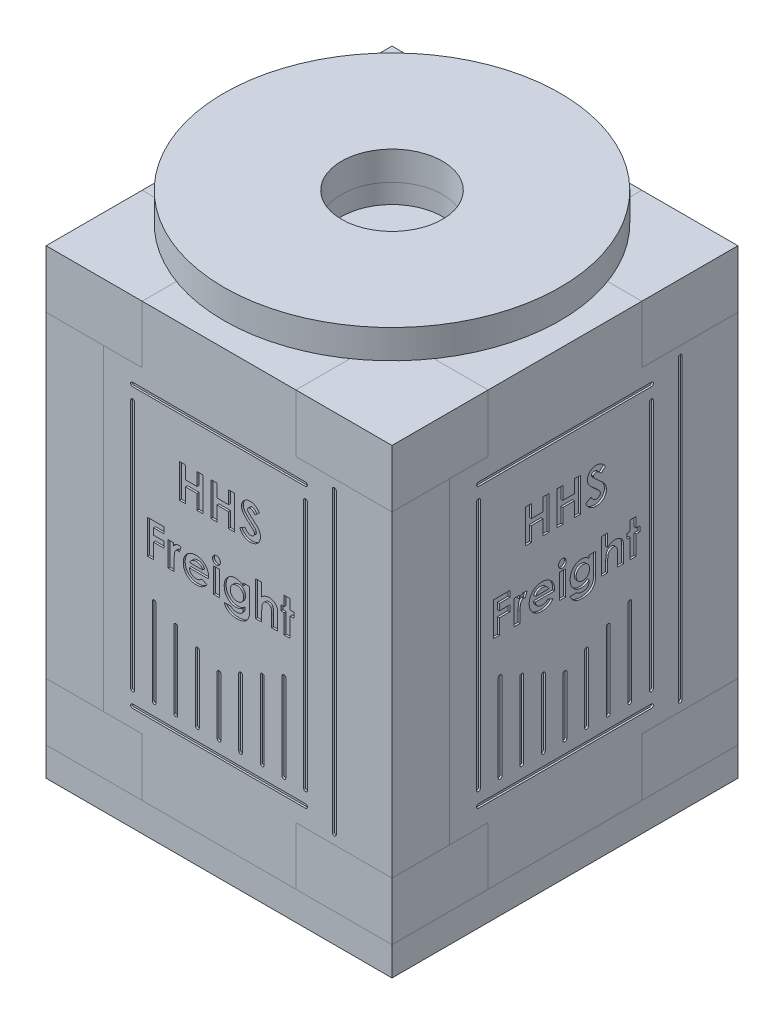
from build123d import *

# Parameters (mm, degrees)
BOSS_EXTRUDE1_DEPTH = 6
BOSS_EXTRUDE2_START = 6
SKETCH1_3_R         = 16
SKETCH1_3_R_2       = 5.25
BOSS_EXTRUDE2_DEPTH = 2
BOSS_EXTRUDE3_DEPTH = 6
SKETCH4_W           = 0.628205128
SKETCH4_H           = 2.557692308
CUT_EXTRUDE1_DEPTH  = 0.2
CIRPATTERN1_COUNT   = 4
BOSS_EXTRUDE4_START = -39
BOSS_EXTRUDE4_DEPTH = 6
SKETCH3_W           = 36
SKETCH3_H           = 36
SKETCH3_R           = 17
BOSS_EXTRUDE5_DEPTH = 3
SKETCH5_R           = 25.455844123
SKETCH5_R_2         = 10
CUT_EXTRUDE2_DEPTH  = 57.107040621
SKETCH6_R           = 17.5
SKETCH6_R_2         = 5.25
BOSS_EXTRUDE6_DEPTH = 3


with BuildPart() as part:
    # Sketch1 → Boss-Extrude1 (new body)
    with BuildSketch(Plane(origin=(0, 0, 0), x_dir=(1, 0, 0), z_dir=(0, 1, 0))):
        Polygon((18, 8), (18, 18), (8, 18), (8, 12), (-8, 12), (-8, 18), (-18, 18), (-18, 8), (-12, 8), (-12, -8), (-18, -8), (-18, -18), (-8, -18), (-8, -12), (8, -12), (8, -18), (18, -18), (18, -8), (12, -8), (12, 8), align=None)
    extrude(amount=BOSS_EXTRUDE1_DEPTH)


with BuildPart() as body_2:
    # Sketch1<3> → Boss-Extrude2 (new body)
    with BuildSketch(Plane(origin=(0, 0, 0), x_dir=(1, 0, 0), z_dir=(0, 1, 0)).offset(BOSS_EXTRUDE2_START)):
        Circle(SKETCH1_3_R)
        Circle(SKETCH1_3_R_2, mode=Mode.SUBTRACT)
    extrude(amount=BOSS_EXTRUDE2_DEPTH)

    # Sketch5 → Cut-Extrude2 (cut, through all)
    with BuildSketch(Plane(origin=(0, 8, 0), x_dir=(1, 0, 0), z_dir=(0, 1, 0))):
        Circle(SKETCH5_R)
        Circle(SKETCH5_R_2, mode=Mode.SUBTRACT)
    extrude(amount=-CUT_EXTRUDE2_DEPTH, mode=Mode.SUBTRACT)


with BuildPart() as body_3:
    # Sketch2 → Boss-Extrude3 (new body)
    with BuildSketch(Plane.XY.offset(12)):
        Polygon((-8, 6), (-8, 0), (-12, 0), (-12, -33), (-8, -33), (-8, -39), (8, -39), (8, -33), (18, -33), (18, 0), (8, 0), (8, 6), align=None)
    extrude(amount=BOSS_EXTRUDE3_DEPTH)

    # Sketch4 → Cut-Extrude1 (cut)
    # profile 1 of 23: a face of its own
    with BuildSketch(Plane.XY.offset(18)):
        with BuildLine():
            Line((12.2, -1), (12.2, -32))
            ThreePointArc((12.2, -32), (12, -32.2), (11.8, -32))
            Line((11.8, -32), (11.8, -1))
            ThreePointArc((11.8, -1), (12, -0.8), (12.2, -1))
        make_face()
    # profile 2 of 23: a face of its own
    with BuildSketch(Plane.XY.offset(18)):
        with BuildLine():
            Line((-9, -1.8), (9, -1.8))
            ThreePointArc((9, -1.8), (9.2, -2), (9, -2.2))
            Line((9, -2.2), (-9, -2.2))
            ThreePointArc((-9, -2.2), (-9.2, -2), (-9, -1.8))
        make_face()
    # profile 3 of 23: a face of its own
    with BuildSketch(Plane.XY.offset(18)):
        with BuildLine():
            Line((-8.8, -3.5), (-8.8, -29.5))
            ThreePointArc((-8.8, -29.5), (-9, -29.7), (-9.2, -29.5))
            Line((-9.2, -29.5), (-9.2, -3.5))
            ThreePointArc((-9.2, -3.5), (-9, -3.3), (-8.8, -3.5))
        make_face()
    # profile 4 of 23: a face of its own
    with BuildSketch(Plane.XY.offset(18)):
        with BuildLine():
            Line((9.2, -3.5), (9.2, -29.5))
            ThreePointArc((9.2, -29.5), (9, -29.7), (8.8, -29.5))
            Line((8.8, -29.5), (8.8, -3.5))
            ThreePointArc((8.8, -3.5), (9, -3.3), (9.2, -3.5))
        make_face()
    # profile 5 of 23: a face of its own
    with BuildSketch(Plane.XY.offset(18)):
        with BuildLine():
            Line((-9, -30.8), (9, -30.8))
            ThreePointArc((9, -30.8), (9.2, -31), (9, -31.2))
            Line((9, -31.2), (-9, -31.2))
            ThreePointArc((-9, -31.2), (-9.2, -31), (-9, -30.8))
        make_face()
    # profile 6 of 23: a face of its own
    with BuildSketch(Plane.XY.offset(18)):
        with BuildLine():
            Line((-4.3, -21.5), (-4.3, -29.5))
            ThreePointArc((-4.3, -29.5), (-4.5, -29.7), (-4.7, -29.5))
            Line((-4.7, -29.5), (-4.7, -21.5))
            ThreePointArc((-4.7, -21.5), (-4.5, -21.3), (-4.3, -21.5))
        make_face()
    # profile 7 of 23: a face of its own
    with BuildSketch(Plane.XY.offset(18)):
        with BuildLine():
            Line((0.2, -23.5), (0.2, -29.5))
            ThreePointArc((0.2, -29.5), (0, -29.7), (-0.2, -29.5))
            Line((-0.2, -29.5), (-0.2, -23.5))
            ThreePointArc((-0.2, -23.5), (0, -23.3), (0.2, -23.5))
        make_face()
    # profile 8 of 23: a face of its own
    with BuildSketch(Plane.XY.offset(18)):
        with BuildLine():
            Line((4.7, -21.5), (4.7, -29.5))
            ThreePointArc((4.7, -29.5), (4.5, -29.7), (4.3, -29.5))
            Line((4.3, -29.5), (4.3, -21.5))
            ThreePointArc((4.3, -21.5), (4.5, -21.3), (4.7, -21.5))
        make_face()
    # profile 9 of 23: a face of its own
    with BuildSketch(Plane.XY.offset(18)):
        with BuildLine():
            Line((-6.95, -29.5), (-6.95, -20.5))
            ThreePointArc((-6.95, -20.5), (-6.75, -20.3), (-6.55, -20.5))
            Line((-6.55, -20.5), (-6.55, -29.5))
            ThreePointArc((-6.55, -29.5), (-6.75, -29.7), (-6.95, -29.5))
        make_face()
    # profile 10 of 23: a face of its own
    with BuildSketch(Plane.XY.offset(18)):
        with BuildLine():
            Line((-2.45, -29.5), (-2.45, -22.5))
            ThreePointArc((-2.45, -22.5), (-2.25, -22.3), (-2.05, -22.5))
            Line((-2.05, -22.5), (-2.05, -29.5))
            ThreePointArc((-2.05, -29.5), (-2.25, -29.7), (-2.45, -29.5))
        make_face()
    # profile 11 of 23: a face of its own
    with BuildSketch(Plane.XY.offset(18)):
        with BuildLine():
            Line((2.05, -29.5), (2.05, -22.5))
            ThreePointArc((2.05, -22.5), (2.25, -22.3), (2.45, -22.5))
            Line((2.45, -22.5), (2.45, -29.5))
            ThreePointArc((2.45, -29.5), (2.25, -29.7), (2.05, -29.5))
        make_face()
    # profile 12 of 23: a face of its own
    with BuildSketch(Plane.XY.offset(18)):
        with BuildLine():
            Line((6.55, -29.5), (6.55, -20.5))
            ThreePointArc((6.55, -20.5), (6.75, -20.3), (6.95, -20.5))
            Line((6.95, -20.5), (6.95, -29.5))
            ThreePointArc((6.95, -29.5), (6.75, -29.7), (6.55, -29.5))
        make_face()
    # profile 13 of 23: a face of its own
    with BuildSketch(Plane.XY.offset(18)):
        Polygon((-4.128205128, -6.5), (-3.5, -6.5), (-3.5, -7.846153846), (-2.288461538, -7.846153846), (-2.288461538, -6.5), (-1.66025641, -6.5), (-1.66025641, -10), (-2.288461538, -10), (-2.288461538, -8.474358974), (-3.5, -8.474358974), (-3.5, -10), (-4.128205128, -10), align=None)
    # profile 14 of 23: a face of its own
    with BuildSketch(Plane.XY.offset(18)):
        Polygon((-0.852564103, -6.5), (-0.224358974, -6.5), (-0.224358974, -7.846153846), (0.987179487, -7.846153846), (0.987179487, -6.5), (1.615384615, -6.5), (1.615384615, -10), (0.987179487, -10), (0.987179487, -8.474358974), (-0.224358974, -8.474358974), (-0.224358974, -10), (-0.852564103, -10), align=None)
    # profile 15 of 23: a face of its own
    with BuildSketch(Plane.XY.offset(18)):
        with BuildLine():
            Line((4.217948718, -6.967648237), (3.748197115, -7.397435897))
            add(Edge.make_bspline(
                [(3.748197115, -7.397435897), (3.710604112, -7.342284932), (3.651542255, -7.266135742), (3.564477212, -7.179353173), (3.501863654, -7.128057989), (3.438377685, -7.088147573), (3.354583209, -7.050940217), (3.288282332, -7.038318777), (3.244791667, -7.038461538)],
                knots=[0, 0, 0, 0, 0.31182434, 0.448432767, 0.573381197, 0.689077147, 0.797572901, 1, 1, 1, 1], degree=3))
            add(Edge.make_bspline(
                [(3.244791667, -7.038461538), (3.206557712, -7.038399993), (3.149571765, -7.045224753), (3.082751576, -7.077110914), (3.040224997, -7.10737123), (3.006585134, -7.143857678), (2.971209697, -7.19395035), (2.961872016, -7.238927969), (2.961538462, -7.267728365)],
                knots=[0, 0, 0, 0, 0.285992887, 0.416634394, 0.547379946, 0.671582838, 0.784400739, 1, 1, 1, 1], degree=3))
            add(Edge.make_bspline(
                [(2.961538462, -7.267728365), (2.961107528, -7.297110404), (2.972276565, -7.357062053), (3.001454887, -7.410477964), (3.019731571, -7.435296474)],
                knots=[0, 0, 0, 0, 0.487115475, 1, 1, 1, 1], degree=3))
            add(Edge.make_bspline(
                [(3.019731571, -7.435296474), (3.037639838, -7.4592137), (3.072502271, -7.496699757), (3.126027145, -7.551264825), (3.181107837, -7.603455423), (3.244687616, -7.664263302), (3.350735792, -7.759198249), (3.435025348, -7.834526673), (3.495092147, -7.88681891)],
                knots=[0, 0, 0, 0, 0.136349281, 0.233805212, 0.349411224, 0.48317915, 0.635966856, 1, 1, 1, 1], degree=3))
            add(Edge.make_bspline(
                [(3.495092147, -7.88681891), (3.550817819, -7.935344696), (3.63071994, -8.00351582), (3.729772015, -8.09103644), (3.791023351, -8.144971888), (3.842723305, -8.191668852), (3.893577336, -8.239212829), (3.926991558, -8.271250658), (3.945913462, -8.290665064)],
                knots=[0, 0, 0, 0, 0.366184141, 0.520457298, 0.655012135, 0.770624226, 0.865677185, 1, 1, 1, 1], degree=3))
            add(Edge.make_bspline(
                [(3.945913462, -8.290665064), (4.006241792, -8.353963636), (4.088556133, -8.449774248), (4.176935089, -8.585267984), (4.226113179, -8.681960916), (4.263196454, -8.77952575), (4.298678861, -8.915500056), (4.30776444, -9.02179742), (4.307692308, -9.093449519)],
                knots=[0, 0, 0, 0, 0.289954183, 0.417138648, 0.535255184, 0.648751095, 0.762405462, 1, 1, 1, 1], degree=3))
            add(Edge.make_bspline(
                [(4.307692308, -9.093449519), (4.308820374, -9.16287785), (4.298614436, -9.265107687), (4.269277064, -9.396773252), (4.236127629, -9.488488932), (4.195659109, -9.576291703), (4.144943936, -9.6588161), (4.085381323, -9.736896695), (4.017114647, -9.80913792), (3.941603277, -9.87469164), (3.860610211, -9.933049761), (3.773343501, -9.981229434), (3.68054822, -10.020910986), (3.582276138, -10.051439785), (3.441347956, -10.082302663), (3.331280311, -10.089881551), (3.256710737, -10.08974359)],
                knots=[0, 0, 0, 0, 0.127926544, 0.18904691, 0.248543693, 0.307607127, 0.36724766, 0.426963056, 0.488617128, 0.550391855, 0.611330734, 0.672556085, 0.734024191, 0.797340621, 0.862249627, 1, 1, 1, 1], degree=3))
            add(Edge.make_bspline(
                [(3.256710737, -10.08974359), (3.197436711, -10.089698506), (3.109666377, -10.084513817), (2.995733877, -10.065700012), (2.914458564, -10.04585589), (2.835916554, -10.020681236), (2.760105014, -9.989938897), (2.687547198, -9.953144246), (2.617694112, -9.911056073), (2.550885372, -9.862186008), (2.486276011, -9.807533407), (2.424508565, -9.746257379), (2.365283335, -9.678503891), (2.308991261, -9.604076966), (2.233715718, -9.495014576), (2.1853492, -9.405752047), (2.153846154, -9.344451122)],
                knots=[0, 0, 0, 0, 0.125868382, 0.18624025, 0.244976651, 0.303357688, 0.361230317, 0.418489049, 0.475936712, 0.534203744, 0.594059429, 0.655468694, 0.718771685, 0.784974607, 0.853522316, 1, 1, 1, 1], degree=3))
            Line((2.153846154, -9.344451122), (2.706330128, -9.012820513))
            add(Edge.make_bspline(
                [(2.706330128, -9.012820513), (2.743958455, -9.081547014), (2.805143824, -9.176722541), (2.900012015, -9.285787913), (2.971068684, -9.34952835), (3.04447885, -9.399514574), (3.144851568, -9.447017414), (3.226154376, -9.461649204), (3.279847756, -9.461538462)],
                knots=[0, 0, 0, 0, 0.307611547, 0.442138888, 0.566229194, 0.681222208, 0.789558005, 1, 1, 1, 1], degree=3))
            add(Edge.make_bspline(
                [(3.279847756, -9.461538462), (3.332637961, -9.461938616), (3.410408062, -9.449952168), (3.504523769, -9.407523755), (3.56432708, -9.36334599), (3.614865787, -9.312288334), (3.664412976, -9.237527546), (3.68023602, -9.172635217), (3.679487179, -9.129907853)],
                knots=[0, 0, 0, 0, 0.275473311, 0.404345843, 0.535429711, 0.661427401, 0.77786684, 1, 1, 1, 1], degree=3))
            add(Edge.make_bspline(
                [(3.679487179, -9.129907853), (3.679393335, -9.089228663), (3.667128045, -9.027295825), (3.631746581, -8.94875075), (3.599907735, -8.899292826), (3.567445124, -8.857885611), (3.536413837, -8.822007652), (3.498622433, -8.782369038), (3.454171056, -8.738919199), (3.403643974, -8.691278), (3.324378938, -8.61872962), (3.260240976, -8.563987211), (3.215344551, -8.526241987)],
                knots=[0, 0, 0, 0, 0.155090822, 0.238351561, 0.32840414, 0.37938386, 0.439617644, 0.509831416, 0.588874645, 0.677436354, 0.77554672, 1, 1, 1, 1], degree=3))
            add(Edge.make_bspline(
                [(3.215344551, -8.526241987), (3.129530539, -8.454270328), (3.00745093, -8.348833194), (2.855593469, -8.209490312), (2.759604265, -8.115389489), (2.675289789, -8.02877406), (2.603211654, -7.948949049), (2.544170578, -7.875296497), (2.482021676, -7.788060941), (2.423089239, -7.681753262), (2.355878072, -7.514632271), (2.332414707, -7.383916332), (2.333333333, -7.297876603)],
                knots=[0, 0, 0, 0, 0.215201009, 0.309902452, 0.395959096, 0.473447494, 0.542140328, 0.602523333, 0.654726333, 0.747804055, 0.835278417, 1, 1, 1, 1], degree=3))
            add(Edge.make_bspline(
                [(2.333333333, -7.297876603), (2.332987333, -7.238812595), (2.341828098, -7.151242057), (2.368898713, -7.038319492), (2.397820656, -6.957913545), (2.435414959, -6.880959983), (2.481057226, -6.807081141), (2.535472114, -6.736957251), (2.59679298, -6.670634675), (2.664353149, -6.610023554), (2.73654973, -6.556527576), (2.812974041, -6.511346225), (2.893159017, -6.473857126), (2.977599722, -6.445190938), (3.096725832, -6.417559898), (3.189394759, -6.410644182), (3.251802885, -6.41025641)],
                knots=[0, 0, 0, 0, 0.12445736, 0.184840915, 0.244566821, 0.304319173, 0.365199786, 0.427420983, 0.491261689, 0.555499002, 0.618604518, 0.680494764, 0.742473305, 0.804990665, 0.868251971, 1, 1, 1, 1], degree=3))
            add(Edge.make_bspline(
                [(3.251802885, -6.41025641), (3.333981971, -6.41029759), (3.457221458, -6.425723612), (3.615290545, -6.475277854), (3.710892278, -6.519802893), (3.786960209, -6.562999189), (3.845259407, -6.602759362), (3.904581302, -6.648309948), (3.965407638, -6.69978876), (4.02659459, -6.758177595), (4.113521937, -6.845819545), (4.176516872, -6.917254334), (4.217948718, -6.967648237)],
                knots=[0, 0, 0, 0, 0.212976528, 0.319776676, 0.428556273, 0.485856803, 0.546558687, 0.611431498, 0.67982091, 0.753158505, 0.830752869, 1, 1, 1, 1], degree=3))
        make_face()
    # profile 16 of 23: a face of its own
    with BuildSketch(Plane.XY.offset(18)):
        Polygon((-7.448717949, -13.198717949), (-5.743589744, -13.198717949), (-5.743589744, -13.826923077), (-6.820512821, -13.826923077), (-6.820512821, -14.5), (-5.743589744, -14.5), (-5.743589744, -15.128205128), (-6.820512821, -15.128205128), (-6.820512821, -16.698717949), (-7.448717949, -16.698717949), align=None)
    # profile 17 of 23: a face of its own
    with BuildSketch(Plane.XY.offset(18)):
        with BuildLine():
            Line((-5.294871795, -14.141025641), (-4.756410256, -14.141025641))
            Line((-4.756410256, -14.141025641), (-4.756410256, -14.455829327))
            add(Edge.make_bspline(
                [(-4.756410256, -14.455829327), (-4.728007426, -14.400717622), (-4.679588115, -14.32212726), (-4.593859931, -14.237966489), (-4.525168988, -14.18642052), (-4.450354488, -14.146319448), (-4.344761972, -14.107749004), (-4.260802231, -14.095522201), (-4.204627404, -14.096153846)],
                knots=[0, 0, 0, 0, 0.268422379, 0.39320538, 0.516430377, 0.637792883, 0.758061252, 1, 1, 1, 1], degree=3))
            add(Edge.make_bspline(
                [(-4.204627404, -14.096153846), (-4.162738896, -14.097104936), (-4.073880523, -14.106653394), (-3.991054995, -14.14030149), (-3.948717949, -14.159254808)],
                knots=[0, 0, 0, 0, 0.474167851, 1, 1, 1, 1], degree=3))
            Line((-3.948717949, -14.159254808), (-4.143629808, -14.69140625))
            add(Edge.make_bspline(
                [(-4.143629808, -14.69140625), (-4.176309315, -14.675730075), (-4.233977006, -14.647551358), (-4.297065933, -14.634935535), (-4.324519231, -14.634615385)],
                knots=[0, 0, 0, 0, 0.570645018, 1, 1, 1, 1], degree=3))
            add(Edge.make_bspline(
                [(-4.324519231, -14.634615385), (-4.34796641, -14.634646625), (-4.383890567, -14.639831562), (-4.427496822, -14.660151418), (-4.459772128, -14.679565584), (-4.489058288, -14.706590665), (-4.518325558, -14.73786744), (-4.544117661, -14.776485806), (-4.571335741, -14.819469165), (-4.594510949, -14.872081037), (-4.614383132, -14.934888679), (-4.632088651, -15.008618937), (-4.644275763, -15.09366318), (-4.656039678, -15.189198775), (-4.665931092, -15.338620615), (-4.669322813, -15.456270451), (-4.668770032, -15.538361378)],
                knots=[0, 0, 0, 0, 0.066912404, 0.101140702, 0.136380892, 0.173597996, 0.214075626, 0.25797978, 0.305417223, 0.358684712, 0.420923911, 0.492691001, 0.574130849, 0.665182153, 0.766512664, 1, 1, 1, 1], degree=3))
            Line((-4.668770032, -15.538361378), (-4.666666667, -15.663161058))
            Line((-4.666666667, -15.663161058), (-4.666666667, -16.698717949))
            Line((-4.666666667, -16.698717949), (-5.294871795, -16.698717949))
            Line((-5.294871795, -16.698717949), (-5.294871795, -14.141025641))
        make_face()
    # profile 18 of 23: a face of its own
    with BuildSketch(Plane.XY.offset(18)):
        with BuildLine():
            Line((-1.079026442, -15.576923077), (-3.096153846, -15.576923077))
            add(Edge.make_bspline(
                [(-3.096153846, -15.576923077), (-3.088732092, -15.623038637), (-3.074437274, -15.69088242), (-3.044002653, -15.776367046), (-3.01717409, -15.835645214), (-2.986338201, -15.891464967), (-2.950375276, -15.943566219), (-2.909736355, -15.991902492), (-2.864657764, -16.036263861), (-2.815890521, -16.076012517), (-2.763671207, -16.110835168), (-2.707945983, -16.139386454), (-2.649353449, -16.163456629), (-2.587456841, -16.182505837), (-2.498740375, -16.200443117), (-2.429752461, -16.20475455), (-2.383112981, -16.205128205)],
                knots=[0, 0, 0, 0, 0.134030228, 0.198035326, 0.259812977, 0.320405484, 0.380626346, 0.441025884, 0.501201994, 0.561690671, 0.621161275, 0.68080151, 0.740902961, 0.802582416, 0.8661864, 1, 1, 1, 1], degree=3))
            add(Edge.make_bspline(
                [(-2.383112981, -16.205128205), (-2.326368973, -16.205444937), (-2.242483297, -16.196728186), (-2.134161169, -16.169505298), (-2.057289469, -16.139720321), (-1.983044395, -16.10256309), (-1.88744375, -16.039957405), (-1.822564661, -15.982045084), (-1.782251603, -15.939403045)],
                knots=[0, 0, 0, 0, 0.251339752, 0.372248681, 0.49428064, 0.616180496, 0.73979102, 1, 1, 1, 1], degree=3))
            Line((-1.782251603, -15.939403045), (-1.256410256, -16.189703526))
            add(Edge.make_bspline(
                [(-1.256410256, -16.189703526), (-1.288487437, -16.235535462), (-1.339927003, -16.301156658), (-1.415220295, -16.381218005), (-1.473466214, -16.43608588), (-1.53417863, -16.48612206), (-1.597165993, -16.531951719), (-1.663354787, -16.572340273), (-1.731420011, -16.609242815), (-1.802769119, -16.640879061), (-1.877204548, -16.667857646), (-1.954411036, -16.692244902), (-2.035363595, -16.710830982), (-2.119387862, -16.725526614), (-2.237801841, -16.739770137), (-2.328581266, -16.743578606), (-2.390124199, -16.743589744)],
                knots=[0, 0, 0, 0, 0.127328193, 0.189420031, 0.250008012, 0.309331145, 0.368386561, 0.427141744, 0.485687056, 0.544504814, 0.604586283, 0.665831547, 0.728668574, 0.793471982, 0.85991395, 1, 1, 1, 1], degree=3))
            add(Edge.make_bspline(
                [(-2.390124199, -16.743589744), (-2.484423986, -16.743719017), (-2.623719859, -16.733619859), (-2.801901969, -16.693176489), (-2.926452073, -16.652957491), (-3.043894652, -16.599795402), (-3.154285122, -16.534788561), (-3.258727131, -16.459167386), (-3.354029295, -16.371349069), (-3.440852117, -16.275763796), (-3.51711287, -16.173111781), (-3.580923198, -16.064110267), (-3.633338747, -15.949480165), (-3.674028317, -15.828929971), (-3.713985913, -15.657682722), (-3.724573496, -15.52403755), (-3.724358974, -15.433894231)],
                knots=[0, 0, 0, 0, 0.135079333, 0.198875647, 0.261192366, 0.322136005, 0.383017164, 0.444315175, 0.506362776, 0.568185367, 0.628944138, 0.689078851, 0.748665675, 0.809078028, 0.870917817, 1, 1, 1, 1], degree=3))
            add(Edge.make_bspline(
                [(-3.724358974, -15.433894231), (-3.724439875, -15.341447109), (-3.714258652, -15.204734742), (-3.673949141, -15.029555365), (-3.633137955, -14.906310515), (-3.581518013, -14.78871479), (-3.516895569, -14.677799445), (-3.440889972, -14.573177718), (-3.354379916, -14.475339091), (-3.258674014, -14.387029386), (-3.156977545, -14.308326507), (-3.048147656, -14.242750683), (-2.933415705, -14.189748334), (-2.81351415, -14.146749682), (-2.642281994, -14.107681495), (-2.509180788, -14.095144172), (-2.418870192, -14.096153846)],
                knots=[0, 0, 0, 0, 0.132705891, 0.195662835, 0.257480813, 0.318728707, 0.379576029, 0.44128114, 0.503990255, 0.566629407, 0.62785986, 0.688182926, 0.748487351, 0.808936094, 0.870586519, 1, 1, 1, 1], degree=3))
            add(Edge.make_bspline(
                [(-2.418870192, -14.096153846), (-2.323898704, -14.09615062), (-2.183611872, -14.105992511), (-2.004336867, -14.146651289), (-1.878815313, -14.186523957), (-1.761364216, -14.241028275), (-1.649406136, -14.304435465), (-1.545625621, -14.381691199), (-1.448916632, -14.46907977), (-1.361617224, -14.566034607), (-1.28530702, -14.671357222), (-1.22037959, -14.784019645), (-1.167743386, -14.904479348), (-1.127092123, -15.03237232), (-1.086851471, -15.216508979), (-1.07676427, -15.360632052), (-1.076923077, -15.458433494)],
                knots=[0, 0, 0, 0, 0.132529453, 0.19498026, 0.255981895, 0.31576785, 0.375179693, 0.435072107, 0.495743018, 0.556655822, 0.616619104, 0.676758309, 0.737601351, 0.799533163, 0.863574585, 1, 1, 1, 1], degree=3))
            Line((-1.076923077, -15.458433494), (-1.079026442, -15.576923077))
        make_face()
        with BuildLine():
            Line((-3.051282051, -15.083333333), (-1.705128205, -15.083333333))
            add(Edge.make_bspline(
                [(-1.705128205, -15.083333333), (-1.726395867, -15.019393934), (-1.770292296, -14.925009996), (-1.864489681, -14.823979815), (-1.946613266, -14.756671347), (-2.040513206, -14.702111199), (-2.179367297, -14.648356226), (-2.292127291, -14.634718277), (-2.367688301, -14.634615385)],
                knots=[0, 0, 0, 0, 0.237159217, 0.356489476, 0.480960692, 0.607829391, 0.735016972, 1, 1, 1, 1], degree=3))
            add(Edge.make_bspline(
                [(-2.367688301, -14.634615385), (-2.450225397, -14.633471662), (-2.612059788, -14.656865086), (-2.759632851, -14.727587814), (-2.823417468, -14.774839744)],
                knots=[0, 0, 0, 0, 0.510296267, 1, 1, 1, 1], degree=3))
            add(Edge.make_bspline(
                [(-2.823417468, -14.774839744), (-2.869692321, -14.807883357), (-2.957634439, -14.904002909), (-3.020521014, -15.017688457), (-3.051282051, -15.083333333)],
                knots=[0, 0, 0, 0, 0.4378973, 1, 1, 1, 1], degree=3))
        make_face(mode=Mode.SUBTRACT)
    # profile 19 of 23: a face of its own
    with BuildSketch(Plane.XY.offset(18)):
        with Locations((-0.269230769, -15.419871795)):
            Rectangle(SKETCH4_W, SKETCH4_H)
    # profile 20 of 23: a face of its own
    with BuildSketch(Plane.XY.offset(18)):
        with BuildLine():
            Line((2.512820513, -14.141025641), (3.185897436, -14.141025641))
            Line((3.185897436, -14.141025641), (3.185897436, -16.322916667))
            add(Edge.make_bspline(
                [(3.185897436, -16.322916667), (3.185476207, -16.423547236), (3.179288851, -16.570033672), (3.151723203, -16.756932234), (3.123166177, -16.881766312), (3.086178918, -16.995633115), (3.027677833, -17.130294403), (2.969649625, -17.220762495), (2.924379006, -17.273637821)],
                knots=[0, 0, 0, 0, 0.300233823, 0.436256712, 0.562884572, 0.681680621, 0.792783658, 1, 1, 1, 1], degree=3))
            add(Edge.make_bspline(
                [(2.924379006, -17.273637821), (2.86676406, -17.342071726), (2.766078095, -17.433140464), (2.611081164, -17.527655669), (2.483349369, -17.586173101), (2.344351576, -17.630642563), (2.138666818, -17.674894509), (1.976618743, -17.686158156), (1.865685096, -17.685897436)],
                knots=[0, 0, 0, 0, 0.228421157, 0.343996608, 0.46295648, 0.586702957, 0.716302913, 1, 1, 1, 1], degree=3))
            add(Edge.make_bspline(
                [(1.865685096, -17.685897436), (1.749745256, -17.685969505), (1.581867906, -17.677033664), (1.370615464, -17.6366491), (1.232854458, -17.595964485), (1.107953022, -17.543424873), (0.993556959, -17.480437561), (0.889891045, -17.405126977), (0.795367318, -17.320471428), (0.712256021, -17.224586888), (0.616151203, -17.08130214), (0.563058598, -16.96160078), (0.535657051, -16.878205128)],
                knots=[0, 0, 0, 0, 0.207410699, 0.299345031, 0.383942479, 0.463709986, 0.54113669, 0.616854835, 0.692286579, 0.767513249, 0.843065229, 1, 1, 1, 1], degree=3))
            Line((0.535657051, -16.878205128), (1.233974359, -16.878205128))
            add(Edge.make_bspline(
                [(1.233974359, -16.878205128), (1.26503984, -16.915162739), (1.31942241, -16.964688601), (1.403614971, -17.015916757), (1.473748705, -17.04774957), (1.550829561, -17.071908958), (1.665624641, -17.097265484), (1.756656506, -17.102188942), (1.818709936, -17.102564103)],
                knots=[0, 0, 0, 0, 0.22365493, 0.337943226, 0.455777244, 0.579824406, 0.711809474, 1, 1, 1, 1], degree=3))
            add(Edge.make_bspline(
                [(1.818709936, -17.102564103), (1.896026111, -17.103183318), (2.006523181, -17.094246451), (2.14368312, -17.060932724), (2.228281556, -17.025438084), (2.301269153, -16.982760806), (2.362158491, -16.933195584), (2.412435389, -16.87859891), (2.445321762, -16.82723727), (2.464864013, -16.780643832), (2.478171311, -16.740411087), (2.488276188, -16.694035527), (2.497478048, -16.642385217), (2.50434082, -16.584794386), (2.510751713, -16.496675491), (2.513727348, -16.427673407), (2.512820513, -16.379707532)],
                knots=[0, 0, 0, 0, 0.19772075, 0.282265633, 0.359994231, 0.431569103, 0.497870001, 0.560090238, 0.620807047, 0.652681998, 0.689174246, 0.729059971, 0.773983044, 0.823375087, 0.877349713, 1, 1, 1, 1], degree=3))
            add(Edge.make_bspline(
                [(2.512820513, -16.379707532), (2.460471605, -16.433592105), (2.377282384, -16.506298501), (2.255146422, -16.582060002), (2.163346901, -16.626213342), (2.067115203, -16.658500545), (1.929160011, -16.690292062), (1.820862368, -16.698345653), (1.747195513, -16.698717949)],
                knots=[0, 0, 0, 0, 0.263927751, 0.385523834, 0.50370538, 0.620733321, 0.741155395, 1, 1, 1, 1], degree=3))
            add(Edge.make_bspline(
                [(1.747195513, -16.698717949), (1.665361876, -16.699270917), (1.543922287, -16.687726887), (1.388116471, -16.64886007), (1.277344921, -16.609106883), (1.172272319, -16.556252336), (1.071403948, -16.49338885), (0.976609077, -16.417194627), (0.886579861, -16.331928698), (0.805209598, -16.237151521), (0.73360801, -16.135361036), (0.673248983, -16.027259379), (0.624152408, -15.912946688), (0.585076047, -15.792904289), (0.548371031, -15.621340262), (0.538785145, -15.487750714), (0.538461538, -15.397435897)],
                knots=[0, 0, 0, 0, 0.123700343, 0.183445285, 0.242476179, 0.301272795, 0.36098846, 0.421869333, 0.484863659, 0.548268086, 0.61043108, 0.672769643, 0.735140257, 0.798288065, 0.863379995, 1, 1, 1, 1], degree=3))
            add(Edge.make_bspline(
                [(0.538461538, -15.397435897), (0.537944023, -15.301428276), (0.549055613, -15.160092116), (0.587875092, -14.978787469), (0.628287483, -14.852891766), (0.681508388, -14.734919717), (0.767182333, -14.586955869), (0.848146317, -14.486903619), (0.909354968, -14.427083333)],
                knots=[0, 0, 0, 0, 0.269734209, 0.396745187, 0.520318914, 0.64054729, 0.759723539, 1, 1, 1, 1], degree=3))
            add(Edge.make_bspline(
                [(0.909354968, -14.427083333), (0.963539226, -14.373317078), (1.05109902, -14.301220277), (1.178686963, -14.223623501), (1.277540453, -14.177289792), (1.380272658, -14.140469809), (1.524579555, -14.105542614), (1.636725198, -14.095915456), (1.712139423, -14.096153846)],
                knots=[0, 0, 0, 0, 0.256681043, 0.3797841, 0.501470579, 0.623319496, 0.746312038, 1, 1, 1, 1], degree=3))
            add(Edge.make_bspline(
                [(1.712139423, -14.096153846), (1.782976711, -14.096826764), (1.889127886, -14.104591497), (2.025731286, -14.138053137), (2.125285453, -14.172152239), (2.22365702, -14.216395602), (2.35743961, -14.296007274), (2.45192716, -14.370234727), (2.512820513, -14.42568109)],
                knots=[0, 0, 0, 0, 0.239799546, 0.357657775, 0.474596033, 0.595177246, 0.721609329, 1, 1, 1, 1], degree=3))
            Line((2.512820513, -14.42568109), (2.512820513, -14.141025641))
        make_face()
        with BuildLine():
            add(Edge.make_bspline(
                [(1.862179487, -14.679487179), (1.813944828, -14.68051911), (1.742109422, -14.684699671), (1.650765167, -14.707192724), (1.586130922, -14.728698172), (1.525081661, -14.757643323), (1.467502925, -14.792954785), (1.412711295, -14.833942665), (1.362450439, -14.881379262), (1.315862309, -14.932635677), (1.276744389, -14.989046208), (1.241886735, -15.047399026), (1.214767447, -15.110041248), (1.192389407, -15.175276509), (1.173615686, -15.268996875), (1.165310893, -15.341162534), (1.166666667, -15.390424679)],
                knots=[0, 0, 0, 0, 0.130325197, 0.19249068, 0.253030534, 0.313596585, 0.374077456, 0.434784119, 0.497609537, 0.5600519, 0.621032311, 0.682272297, 0.742887436, 0.804620819, 0.867735932, 1, 1, 1, 1], degree=3))
            add(Edge.make_bspline(
                [(1.166666667, -15.390424679), (1.165735004, -15.441455064), (1.172789517, -15.516248842), (1.193304604, -15.612767862), (1.215915015, -15.679803462), (1.244268729, -15.743661432), (1.278316103, -15.804311612), (1.320348971, -15.86030356), (1.367024224, -15.912869605), (1.418659873, -15.960395246), (1.474241068, -16.001732612), (1.532623362, -16.037430696), (1.595069517, -16.065267465), (1.660225599, -16.087811141), (1.752927034, -16.110026622), (1.825369233, -16.114427353), (1.874098558, -16.115384615)],
                knots=[0, 0, 0, 0, 0.134674643, 0.197931502, 0.260447922, 0.321293636, 0.382442821, 0.443853595, 0.505984202, 0.568071793, 0.628986467, 0.688848821, 0.748567548, 0.80932852, 0.870916168, 1, 1, 1, 1], degree=3))
            add(Edge.make_bspline(
                [(1.874098558, -16.115384615), (1.921862014, -16.116295801), (1.992077731, -16.10931007), (2.082337326, -16.088549487), (2.145640837, -16.066872113), (2.2053682, -16.038529222), (2.262321762, -16.004718321), (2.315293184, -15.963800023), (2.365287182, -15.917539917), (2.410403456, -15.866099682), (2.450226446, -15.810364895), (2.482938038, -15.750325551), (2.51080754, -15.686931723), (2.531419905, -15.619291081), (2.552815591, -15.522462386), (2.557777848, -15.446665638), (2.557692308, -15.395332532)],
                knots=[0, 0, 0, 0, 0.128347402, 0.189067593, 0.248938142, 0.308023861, 0.366703119, 0.426834097, 0.487804601, 0.549753476, 0.610659063, 0.671749482, 0.733442395, 0.796702453, 0.861717283, 1, 1, 1, 1], degree=3))
            add(Edge.make_bspline(
                [(2.557692308, -15.395332532), (2.557888388, -15.344678441), (2.552710278, -15.269853223), (2.53147117, -15.174147097), (2.5105746, -15.107102746), (2.483310003, -15.043737435), (2.449128334, -14.984642423), (2.410038181, -14.928726118), (2.364011423, -14.877893211), (2.314401258, -14.830877733), (2.259707344, -14.791102912), (2.202664821, -14.755962027), (2.141348044, -14.728093566), (2.076517438, -14.706181807), (1.983604153, -14.68563838), (1.911349637, -14.678542653), (1.862179487, -14.679487179)],
                knots=[0, 0, 0, 0, 0.135592213, 0.199608616, 0.261894986, 0.32322003, 0.383707537, 0.444249949, 0.505361089, 0.566851635, 0.626748183, 0.685935715, 0.745802887, 0.806500057, 0.868685934, 1, 1, 1, 1], degree=3))
        make_face(mode=Mode.SUBTRACT)
    # profile 21 of 23: a face of its own
    with BuildSketch(Plane.XY.offset(18)):
        with BuildLine():
            Line((3.814102564, -13.108974359), (4.442307692, -13.108974359))
            Line((4.442307692, -13.108974359), (4.442307692, -14.41796875))
            add(Edge.make_bspline(
                [(4.442307692, -14.41796875), (4.503000236, -14.3666722), (4.596985449, -14.297034355), (4.729000232, -14.220978296), (4.826384245, -14.1757499), (4.924193866, -14.140391429), (5.054788947, -14.106796775), (5.154809376, -14.095565784), (5.221254006, -14.096153846)],
                knots=[0, 0, 0, 0, 0.27705221, 0.40661201, 0.53055457, 0.650912889, 0.768692568, 1, 1, 1, 1], degree=3))
            add(Edge.make_bspline(
                [(5.221254006, -14.096153846), (5.283635482, -14.0966423), (5.376153491, -14.103249157), (5.494942908, -14.131246311), (5.579065966, -14.159537254), (5.65893566, -14.197645623), (5.762091459, -14.257490138), (5.831536323, -14.315567767), (5.874699519, -14.357672276)],
                knots=[0, 0, 0, 0, 0.259226034, 0.38275359, 0.505762088, 0.626831502, 0.749441591, 1, 1, 1, 1], degree=3))
            add(Edge.make_bspline(
                [(5.874699519, -14.357672276), (5.913062977, -14.3953421), (5.963240017, -14.460045695), (6.015392878, -14.557149917), (6.04773673, -14.637290672), (6.071738608, -14.724219493), (6.097403097, -14.852065262), (6.102125388, -14.952830891), (6.102564103, -15.021634615)],
                knots=[0, 0, 0, 0, 0.223433368, 0.338330364, 0.457908398, 0.582303259, 0.713170132, 1, 1, 1, 1], degree=3))
            Line((6.102564103, -15.021634615), (6.102564103, -16.698717949))
            Line((6.102564103, -16.698717949), (5.474358974, -16.698717949))
            Line((5.474358974, -16.698717949), (5.474358974, -15.586738782))
            add(Edge.make_bspline(
                [(5.474358974, -15.586738782), (5.474336129, -15.519192257), (5.473292577, -15.422158525), (5.46847646, -15.298768954), (5.463794009, -15.219497464), (5.457251308, -15.149410147), (5.450816928, -15.088004721), (5.441787744, -15.035575518), (5.428267735, -14.97860618), (5.406265134, -14.917673025), (5.374291635, -14.852720291), (5.331584317, -14.799116323), (5.282159478, -14.754899366), (5.225019034, -14.721177415), (5.138780639, -14.686859741), (5.067290427, -14.680082818), (5.019330929, -14.679487179)],
                knots=[0, 0, 0, 0, 0.174836756, 0.251113675, 0.319597982, 0.380332101, 0.433304579, 0.479348275, 0.517933832, 0.584705725, 0.646659628, 0.704382078, 0.760945542, 0.817379482, 0.875228571, 1, 1, 1, 1], degree=3))
            add(Edge.make_bspline(
                [(5.019330929, -14.679487179), (4.955455538, -14.678529708), (4.860488626, -14.694527288), (4.746380555, -14.74974551), (4.66987383, -14.806060247), (4.603259566, -14.876716923), (4.526516666, -14.990059218), (4.488986234, -15.088526435), (4.471754808, -15.157652244)],
                knots=[0, 0, 0, 0, 0.243247312, 0.359969143, 0.480397561, 0.603252137, 0.728257616, 1, 1, 1, 1], degree=3))
            add(Edge.make_bspline(
                [(4.471754808, -15.157652244), (4.464918133, -15.182441376), (4.460293781, -15.225009292), (4.452454302, -15.287676321), (4.45012692, -15.348371504), (4.445871538, -15.418188482), (4.443673035, -15.529712732), (4.44235424, -15.61804233), (4.442307692, -15.679987981)],
                knots=[0, 0, 0, 0, 0.146619126, 0.244883638, 0.361488535, 0.494127117, 0.645383229, 1, 1, 1, 1], degree=3))
            Line((4.442307692, -15.679987981), (4.442307692, -16.698717949))
            Line((4.442307692, -16.698717949), (3.814102564, -16.698717949))
            Line((3.814102564, -16.698717949), (3.814102564, -13.108974359))
        make_face()
    # profile 22 of 23: a face of its own
    with BuildSketch(Plane.XY.offset(18)):
        Polygon((6.775641026, -13.108974359), (7.403846154, -13.108974359), (7.403846154, -14.141025641), (7.807692308, -14.141025641), (7.807692308, -14.679487179), (7.403846154, -14.679487179), (7.403846154, -16.698717949), (6.775641026, -16.698717949), (6.775641026, -14.679487179), (6.461538462, -14.679487179), (6.461538462, -14.141025641), (6.775641026, -14.141025641), align=None)
    # profile 23 of 23: a face of its own
    with BuildSketch(Plane.XY.offset(18)):
        with BuildLine():
            add(Edge.make_bspline(
                [(-0.270633013, -13.064102564), (-0.217485335, -13.063227975), (-0.137801672, -13.07970433), (-0.04432081, -13.133433412), (0.017488444, -13.188112538), (0.068845714, -13.253510399), (0.121941693, -13.352145126), (0.133574983, -13.43688915), (0.134615385, -13.492487981)],
                knots=[0, 0, 0, 0, 0.242962799, 0.363854564, 0.490606197, 0.618739544, 0.743300131, 1, 1, 1, 1], degree=3))
            add(Edge.make_bspline(
                [(0.134615385, -13.492487981), (0.134204166, -13.547669626), (0.120947002, -13.630886587), (0.069910106, -13.729474128), (0.018145903, -13.793901548), (-0.042990817, -13.847712425), (-0.134350668, -13.902278432), (-0.213643155, -13.916637185), (-0.26572516, -13.916666667)],
                knots=[0, 0, 0, 0, 0.256468948, 0.381954886, 0.51070434, 0.637377053, 0.757775202, 1, 1, 1, 1], degree=3))
            add(Edge.make_bspline(
                [(-0.26572516, -13.916666667), (-0.319392576, -13.91761067), (-0.399538884, -13.900936949), (-0.494291383, -13.847603586), (-0.555838607, -13.791808627), (-0.607765947, -13.725938957), (-0.658730773, -13.624867496), (-0.673197996, -13.540134597), (-0.673076923, -13.483373397)],
                knots=[0, 0, 0, 0, 0.242758603, 0.363442651, 0.489711254, 0.617482185, 0.742279995, 1, 1, 1, 1], degree=3))
            add(Edge.make_bspline(
                [(-0.673076923, -13.483373397), (-0.672194914, -13.428817642), (-0.659869191, -13.346069784), (-0.608054387, -13.249264313), (-0.557071194, -13.185063458), (-0.495803963, -13.131399491), (-0.402387439, -13.07932919), (-0.323425772, -13.063674192), (-0.270633013, -13.064102564)],
                knots=[0, 0, 0, 0, 0.255026588, 0.378937478, 0.506522648, 0.634371171, 0.754975888, 1, 1, 1, 1], degree=3))
        make_face()
    extrude(amount=-CUT_EXTRUDE1_DEPTH, mode=Mode.SUBTRACT)


with BuildPart() as cirpattern1_1:
    # CirPattern1: pattern copy
    add(body_3.part.rotate(Axis((0, 8, 0), (0, -1, 0)), 1 * 360 / CIRPATTERN1_COUNT))


with BuildPart() as cirpattern1_2:
    # CirPattern1: pattern copy
    add(body_3.part.rotate(Axis((0, 8, 0), (0, -1, 0)), 2 * 360 / CIRPATTERN1_COUNT))


with BuildPart() as cirpattern1_3:
    # CirPattern1: pattern copy
    add(body_3.part.rotate(Axis((0, 8, 0), (0, -1, 0)), 3 * 360 / CIRPATTERN1_COUNT))


with BuildPart() as body_7:
    # Sketch1<4> → Boss-Extrude4 (new body)
    with BuildSketch(Plane(origin=(0, 0, 0), x_dir=(1, 0, 0), z_dir=(0, 1, 0)).offset(BOSS_EXTRUDE4_START)):
        Polygon((18, 8), (18, 18), (8, 18), (8, 12), (-8, 12), (-8, 18), (-18, 18), (-18, 8), (-12, 8), (-12, -8), (-18, -8), (-18, -18), (-8, -18), (-8, -12), (8, -12), (8, -18), (18, -18), (18, -8), (12, -8), (12, 8), align=None)
    extrude(amount=BOSS_EXTRUDE4_DEPTH)


with BuildPart() as body_8:
    # Sketch3 → Boss-Extrude5 (new body)
    with BuildSketch(Plane.XZ.offset(39)):
        Rectangle(SKETCH3_W, SKETCH3_H)
        Circle(SKETCH3_R, mode=Mode.SUBTRACT)
    extrude(amount=BOSS_EXTRUDE5_DEPTH)


with BuildPart() as body_9:
    # Sketch6 → Boss-Extrude6 (new body)
    with BuildSketch(Plane(origin=(0, 8, 0), x_dir=(1, 0, 0), z_dir=(0, 1, 0))):
        Circle(SKETCH6_R)
        Circle(SKETCH6_R_2, mode=Mode.SUBTRACT)
    extrude(amount=BOSS_EXTRUDE6_DEPTH)


solid = Compound([part.part, body_2.part, body_3.part, cirpattern1_1.part, cirpattern1_2.part, cirpattern1_3.part, body_7.part, body_8.part, body_9.part])
